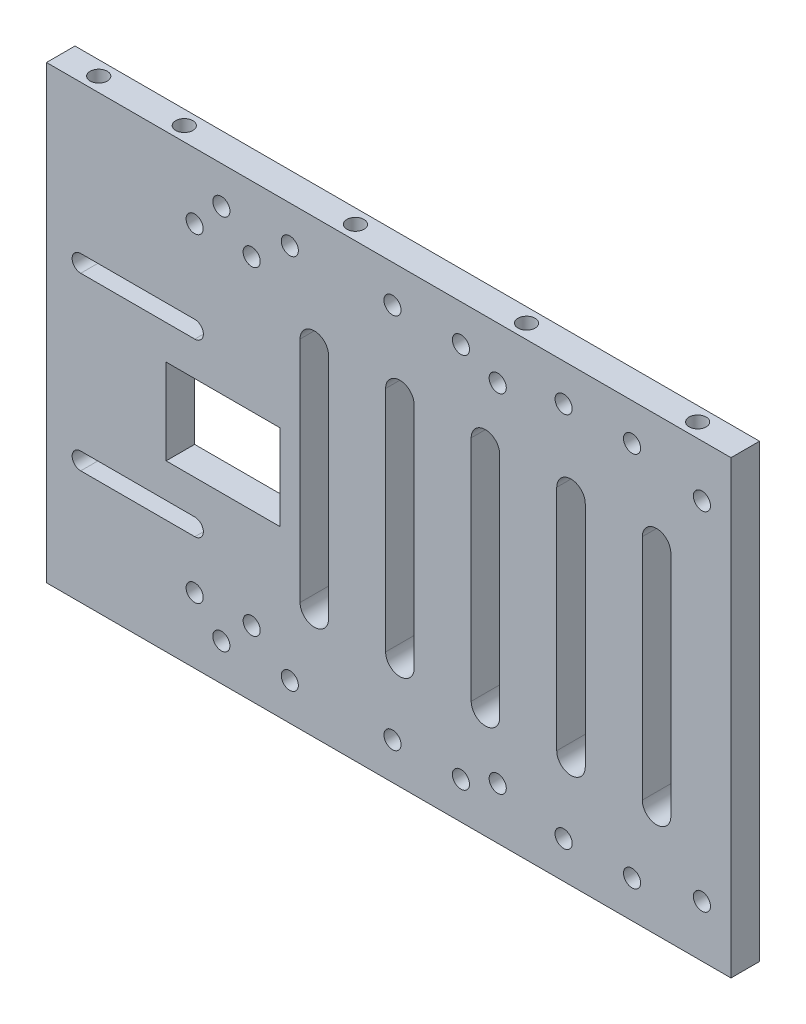
from build123d import *

# Parameters (mm, degrees)
SKETCH_1_W               = 120
SKETCH_1_H               = 79
EXTRUDE_1_DEPTH          = 5
SKETCH_2_R               = 3.1
CUT_EXTRUDE_1_DEPTH      = 2
SKETCH_3_R               = 1.5
CUT_EXTRUDE_2_DEPTH      = 72.897496479
PATTERN_LINEAR_1_COUNT   = 3
PATTERN_LINEAR_1_PITCH   = 30
MIRROR_2_COPY_1_SKETCH_R = 3.1
MIRROR_2_COPY_1_DEPTH    = 2
MIRROR_2_COPY_2_SKETCH_R = 3.1
MIRROR_2_COPY_2_DEPTH    = 2
MIRROR_2_COPY_3_SKETCH_R = 1.5
MIRROR_2_COPY_3_DEPTH    = 72.897496479
MIRROR_2_COPY_4_SKETCH_R = 1.5
MIRROR_2_COPY_4_DEPTH    = 72.897496479
MIRROR_2_COPY_5_SKETCH_R = 3.1
MIRROR_2_COPY_5_DEPTH    = 2
MIRROR_2_COPY_6_SKETCH_R = 1.5
MIRROR_2_COPY_6_DEPTH    = 72.897496479
CUT_EXTRUDE_3_DEPTH      = 1.5
CUT_EXTRUDE_4_DEPTH      = 72.920094549
SKETCH_7_R               = 1.5
CUT_EXTRUDE_6_DEPTH      = 5
SKETCH_9_R               = 1.5
CUT_EXTRUDE_7_DEPTH      = 73.008680032
SKETCH_11_W              = 20
SKETCH_11_H              = 15
CUT_EXTRUDE_8_DEPTH      = 73.008680032


with BuildPart() as part:
    # 草图1 → 凸台-拉伸1 (new body)
    with BuildSketch(Plane.XY):
        Rectangle(SKETCH_1_W, SKETCH_1_H)
    extrude(amount=EXTRUDE_1_DEPTH)

    # 草图2 → 切除-拉伸1 (cut)
    with BuildSketch(Plane(origin=(0, 0, 0), x_dir=(-1, 0, 0), z_dir=(0, 0, -1))):
        with Locations((-42.655984764, -33)):
            Circle(SKETCH_2_R)
        with Locations((-30.655984764, -33)):
            Circle(SKETCH_2_R)
    cut_extrude_1 = extrude(amount=-CUT_EXTRUDE_1_DEPTH, mode=Mode.SUBTRACT)

    # 草图3 → 切除-拉伸2 (cut, through all)
    with BuildSketch(Plane(origin=(0, 0, 2), x_dir=(-1, 0, 0), z_dir=(0, 0, -1))):
        with Locations((-42.655984764, -33)):
            Circle(SKETCH_3_R)
        with Locations((-30.655984764, -33)):
            Circle(SKETCH_3_R)
    cut_extrude_2 = extrude(amount=-CUT_EXTRUDE_2_DEPTH, mode=Mode.SUBTRACT)

    # 阵列(线性)1: 切除-拉伸1, 切除-拉伸2 ×3
    with Locations(*[(-i * PATTERN_LINEAR_1_PITCH, 0, 0) for i in range(1, PATTERN_LINEAR_1_COUNT)]):
        add(cut_extrude_1, mode=Mode.SUBTRACT)
        add(cut_extrude_2, mode=Mode.SUBTRACT)

    # 镜向2 copy 1 sketch → 镜向2 copy 1 (cut)
    with BuildSketch(Plane(origin=(-30, 0, 0), x_dir=(-1, 0, 0), z_dir=(0, 0, -1))):
        with Locations((-42.655984764, 33)):
            Circle(MIRROR_2_COPY_1_SKETCH_R)
        with Locations((-30.655984764, 33)):
            Circle(MIRROR_2_COPY_1_SKETCH_R)
    extrude(amount=-MIRROR_2_COPY_1_DEPTH, mode=Mode.SUBTRACT)

    # 镜向2 copy 2 sketch → 镜向2 copy 2 (cut)
    with BuildSketch(Plane(origin=(-60, 0, 0), x_dir=(-1, 0, 0), z_dir=(0, 0, -1))):
        with Locations((-42.655984764, 33)):
            Circle(MIRROR_2_COPY_2_SKETCH_R)
        with Locations((-30.655984764, 33)):
            Circle(MIRROR_2_COPY_2_SKETCH_R)
    extrude(amount=-MIRROR_2_COPY_2_DEPTH, mode=Mode.SUBTRACT)

    # 镜向2 copy 3 sketch → 镜向2 copy 3 (cut, through all)
    with BuildSketch(Plane(origin=(-30, 0, 2), x_dir=(-1, 0, 0), z_dir=(0, 0, -1))):
        with Locations((-42.655984764, 33)):
            Circle(MIRROR_2_COPY_3_SKETCH_R)
        with Locations((-30.655984764, 33)):
            Circle(MIRROR_2_COPY_3_SKETCH_R)
    extrude(amount=-MIRROR_2_COPY_3_DEPTH, mode=Mode.SUBTRACT)

    # 镜向2 copy 4 sketch → 镜向2 copy 4 (cut, through all)
    with BuildSketch(Plane(origin=(-60, 0, 2), x_dir=(-1, 0, 0), z_dir=(0, 0, -1))):
        with Locations((-42.655984764, 33)):
            Circle(MIRROR_2_COPY_4_SKETCH_R)
        with Locations((-30.655984764, 33)):
            Circle(MIRROR_2_COPY_4_SKETCH_R)
    extrude(amount=-MIRROR_2_COPY_4_DEPTH, mode=Mode.SUBTRACT)

    # 镜向2 copy 5 sketch → 镜向2 copy 5 (cut)
    with BuildSketch(Plane(origin=(0, 0, 0), x_dir=(-1, 0, 0), z_dir=(0, 0, -1))):
        with Locations((-42.655984764, 33)):
            Circle(MIRROR_2_COPY_5_SKETCH_R)
        with Locations((-30.655984764, 33)):
            Circle(MIRROR_2_COPY_5_SKETCH_R)
    extrude(amount=-MIRROR_2_COPY_5_DEPTH, mode=Mode.SUBTRACT)

    # 镜向2 copy 6 sketch → 镜向2 copy 6 (cut, through all)
    with BuildSketch(Plane(origin=(0, 0, 2), x_dir=(-1, 0, 0), z_dir=(0, 0, -1))):
        with Locations((-42.655984764, 33)):
            Circle(MIRROR_2_COPY_6_SKETCH_R)
        with Locations((-30.655984764, 33)):
            Circle(MIRROR_2_COPY_6_SKETCH_R)
    extrude(amount=-MIRROR_2_COPY_6_DEPTH, mode=Mode.SUBTRACT)

    # 草图4 → 切除-拉伸3 (cut)
    with BuildSketch(Plane(origin=(0, 0, 0), x_dir=(-1, 0, 0), z_dir=(0, 0, -1))):
        with BuildLine():
            Line((34, 15.1), (54, 15.1))
            ThreePointArc((54, 15.1), (57.1, 12), (54, 8.9))
            Line((54, 8.9), (34, 8.9))
            ThreePointArc((34, 8.9), (30.9, 12), (34, 15.1))
        make_face()
        with BuildLine():
            Line((34, -21.1), (54, -21.1))
            ThreePointArc((54, -21.1), (57.1, -18), (54, -14.9))
            Line((54, -14.9), (34, -14.9))
            ThreePointArc((34, -14.9), (30.9, -18), (34, -21.1))
        make_face()
    extrude(amount=-CUT_EXTRUDE_3_DEPTH, mode=Mode.SUBTRACT)

    # 草图5 → 切除-拉伸4 (cut, through all)
    with BuildSketch(Plane(origin=(0, 0, 1.5), x_dir=(-1, 0, 0), z_dir=(0, 0, -1))):
        with BuildLine():
            Line((54, 10.5), (34, 10.5))
            ThreePointArc((34, 10.5), (32.5, 12), (34, 13.5))
            Line((34, 13.5), (54, 13.5))
            ThreePointArc((54, 13.5), (55.5, 12), (54, 10.5))
        make_face()
        with BuildLine():
            Line((54, -16.5), (34, -16.5))
            ThreePointArc((34, -16.5), (32.5, -18), (34, -19.5))
            Line((34, -19.5), (54, -19.5))
            ThreePointArc((54, -19.5), (55.5, -18), (54, -16.5))
        make_face()
    extrude(amount=-CUT_EXTRUDE_4_DEPTH, mode=Mode.SUBTRACT)

    # 草图7 → 切除-拉伸6 (cut)
    with BuildSketch(Plane.XZ.offset(39.5)):
        with Locations((51.655984764, 2.5)):
            Circle(SKETCH_7_R)
        with Locations((21.655984764, 2.5)):
            Circle(SKETCH_7_R)
        with Locations((-8.344015236, 2.5)):
            Circle(SKETCH_7_R)
        with Locations((-38.344015236, 2.5)):
            Circle(SKETCH_7_R)
        with Locations((-53.344015236, 2.5)):
            Circle(SKETCH_7_R)
    cut_extrude_6 = extrude(amount=-CUT_EXTRUDE_6_DEPTH, mode=Mode.SUBTRACT)

    # 镜向3: 切除-拉伸6 across plane
    add(cut_extrude_6.mirror(Plane.ZX), mode=Mode.SUBTRACT)

    # 草图9 → 切除-拉伸7 (cut, through all)
    with BuildSketch(Plane(origin=(0, 0, 0), x_dir=(-1, 0, 0), z_dir=(0, 0, -1))):
        with Locations((24.027682272, -28)):
            Circle(SKETCH_9_R)
        with Locations((34.027682272, -28)):
            Circle(SKETCH_9_R)
        with Locations((24.027682272, 28)):
            Circle(SKETCH_9_R)
        with Locations((34.027682272, 28)):
            Circle(SKETCH_9_R)
        with Locations((-19.103783252, 30.4)):
            Circle(SKETCH_9_R)
        with Locations((-54.903783252, 30.4)):
            Circle(SKETCH_9_R)
        with Locations((-19.103783252, -30.4)):
            Circle(SKETCH_9_R)
        with Locations((-54.903783252, -30.4)):
            Circle(SKETCH_9_R)
        with BuildLine():
            Line((-49.452559424, -20.266203112), (-49.452559424, 19.733796888))
            ThreePointArc((-49.452559424, 19.733796888), (-46.952559424, 22.233796888), (-44.452559424, 19.733796888))
            Line((-44.452559424, 19.733796888), (-44.452559424, -20.266203112))
            ThreePointArc((-44.452559424, -20.266203112), (-46.952559424, -22.766203112), (-49.452559424, -20.266203112))
        make_face()
        with BuildLine():
            Line((-34.452559424, -20.266203112), (-34.452559424, 19.733796888))
            ThreePointArc((-34.452559424, 19.733796888), (-31.952559424, 22.233796888), (-29.452559424, 19.733796888))
            Line((-29.452559424, 19.733796888), (-29.452559424, -20.266203112))
            ThreePointArc((-29.452559424, -20.266203112), (-31.952559424, -22.766203112), (-34.452559424, -20.266203112))
        make_face()
        with BuildLine():
            Line((-19.452559424, -20.266203112), (-19.452559424, 19.733796888))
            ThreePointArc((-19.452559424, 19.733796888), (-16.952559424, 22.233796888), (-14.452559424, 19.733796888))
            Line((-14.452559424, 19.733796888), (-14.452559424, -20.266203112))
            ThreePointArc((-14.452559424, -20.266203112), (-16.952559424, -22.766203112), (-19.452559424, -20.266203112))
        make_face()
        with BuildLine():
            Line((-4.452559424, -20.266203112), (-4.452559424, 19.733796888))
            ThreePointArc((-4.452559424, 19.733796888), (-1.952559424, 22.233796888), (0.547440576, 19.733796888))
            Line((0.547440576, 19.733796888), (0.547440576, -20.266203112))
            ThreePointArc((0.547440576, -20.266203112), (-1.952559424, -22.766203112), (-4.452559424, -20.266203112))
        make_face()
        with BuildLine():
            Line((10.547440576, -20.266203112), (10.547440576, 19.733796888))
            ThreePointArc((10.547440576, 19.733796888), (13.047440576, 22.233796888), (15.547440576, 19.733796888))
            Line((15.547440576, 19.733796888), (15.547440576, -20.266203112))
            ThreePointArc((15.547440576, -20.266203112), (13.047440576, -22.766203112), (10.547440576, -20.266203112))
        make_face()
    extrude(amount=-CUT_EXTRUDE_7_DEPTH, mode=Mode.SUBTRACT)

    # 草图11 → 切除-拉伸8 (cut, through all)
    with BuildSketch(Plane.XY.offset(5)):
        with Locations((-29.027682272, -3)):
            Rectangle(SKETCH_11_W, SKETCH_11_H)
    extrude(amount=-CUT_EXTRUDE_8_DEPTH, mode=Mode.SUBTRACT)


solid = part.part
